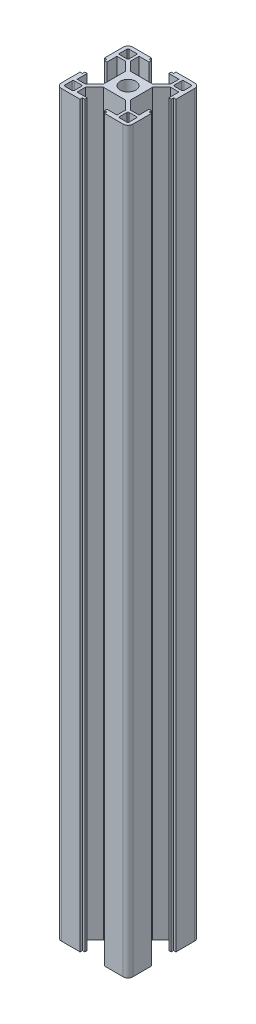
from build123d import *

# Parameters (mm, degrees)
SKETCH1_W           = 4
SKETCH1_H           = 4
SKETCH1_R           = 3.25
BOSS_EXTRUDE1_DEPTH = 310
SKETCH2_W           = 1
SKETCH2_H           = 1
CUT_EXTRUDE1_DEPTH  = 311.724958766
FILLET1_R           = 0.5


with BuildPart() as part:
    # Sketch1 → Boss-Extrude1 (new body)
    with BuildSketch(Plane(origin=(0, 0, 0), x_dir=(1, 0, 0), z_dir=(0, 1, 0))):
        with BuildLine():
            Line((-8.375, 9.50637085), (-8.375, 13))
            Line((-8.375, 13), (-4.125, 13))
            Line((-4.125, 13), (-4.125, 15))
            Line((-4.125, 15), (-13, 15))
            ThreePointArc((-13, 15), (-14.414213562, 14.414213562), (-15, 13))
            Line((-15, 13), (-15, 4.125))
            Line((-15, 4.125), (-13, 4.125))
            Line((-13, 4.125), (-13, 8.375))
            Line((-13, 8.375), (-9.50637085, 8.375))
            Line((-9.50637085, 8.375), (-5.75, 4.61862915))
            Line((-5.75, 4.61862915), (-5.75, -4.61862915))
            Line((-5.75, -4.61862915), (-9.50637085, -8.375))
            Line((-9.50637085, -8.375), (-13, -8.375))
            Line((-13, -8.375), (-13, -4.125))
            Line((-13, -4.125), (-15, -4.125))
            Line((-15, -4.125), (-15, -13))
            ThreePointArc((-15, -13), (-14.414213562, -14.414213562), (-13, -15))
            Line((-13, -15), (-4.125, -15))
            Line((-4.125, -15), (-4.125, -13))
            Line((-4.125, -13), (-8.375, -13))
            Line((-8.375, -13), (-8.375, -9.50637085))
            Line((-8.375, -9.50637085), (-4.61862915, -5.75))
            Line((-4.61862915, -5.75), (4.61862915, -5.75))
            Line((4.61862915, -5.75), (8.375, -9.50637085))
            Line((8.375, -9.50637085), (8.375, -13))
            Line((8.375, -13), (4.125, -13))
            Line((4.125, -13), (4.125, -15))
            Line((4.125, -15), (13, -15))
            ThreePointArc((13, -15), (14.414213562, -14.414213562), (15, -13))
            Line((15, -13), (15, -4.125))
            Line((15, -4.125), (13, -4.125))
            Line((13, -4.125), (13, -8.375))
            Line((13, -8.375), (9.50637085, -8.375))
            Line((9.50637085, -8.375), (5.75, -4.61862915))
            Line((5.75, -4.61862915), (5.75, 4.61862915))
            Line((5.75, 4.61862915), (9.50637085, 8.375))
            Line((9.50637085, 8.375), (13, 8.375))
            Line((13, 8.375), (13, 4.125))
            Line((13, 4.125), (15, 4.125))
            Line((15, 4.125), (15, 13))
            ThreePointArc((15, 13), (14.414213562, 14.414213562), (13, 15))
            Line((13, 15), (4.125, 15))
            Line((4.125, 15), (4.125, 13))
            Line((4.125, 13), (8.375, 13))
            Line((8.375, 13), (8.375, 9.50637085))
            Line((8.375, 9.50637085), (4.61862915, 5.75))
            Line((4.61862915, 5.75), (-4.61862915, 5.75))
            Line((-4.61862915, 5.75), (-8.375, 9.50637085))
        make_face()
        with Locations((-11.5, -11.5)):
            Rectangle(SKETCH1_W, SKETCH1_H, mode=Mode.SUBTRACT)
        with Locations((11.5, -11.5)):
            Rectangle(SKETCH1_W, SKETCH1_H, mode=Mode.SUBTRACT)
        Polygon((-9.5, 9.5), (-10.63137085, 9.5), (-13.5, 9.5), (-13.5, 13.5), (-9.5, 13.5), align=None, mode=Mode.SUBTRACT)
        Circle(SKETCH1_R, mode=Mode.SUBTRACT)
        with Locations((11.5, 11.5)):
            Rectangle(SKETCH1_W, SKETCH1_H, mode=Mode.SUBTRACT)
    extrude(amount=BOSS_EXTRUDE1_DEPTH)

    # Sketch2 → Cut-Extrude1 (cut, through all)
    with BuildSketch(Plane(origin=(0, 310, 0), x_dir=(1, 0, 0), z_dir=(0, 1, 0))):
        with Locations((14.5, 4.625)):
            Rectangle(SKETCH2_W, SKETCH2_H)
        with Locations((-4.625, 14.5)):
            Rectangle(SKETCH2_W, SKETCH2_H)
        with Locations((4.625, 14.5)):
            Rectangle(SKETCH2_W, SKETCH2_H)
        with Locations((14.5, -4.625)):
            Rectangle(SKETCH2_W, SKETCH2_H)
        with Locations((4.625, -14.5)):
            Rectangle(SKETCH2_W, SKETCH2_H)
        with Locations((-4.625, -14.5)):
            Rectangle(SKETCH2_W, SKETCH2_H)
        with Locations((-14.5, -4.625)):
            Rectangle(SKETCH2_W, SKETCH2_H)
        with Locations((-14.5, 4.625)):
            Rectangle(SKETCH2_W, SKETCH2_H)
    extrude(amount=-CUT_EXTRUDE1_DEPTH, mode=Mode.SUBTRACT)

    # Fillet1
    fillet1_edges = [part.edges().sort_by_distance(p)[0] for p in [
        (9.5, 155, 13.5),
        (-13.5, 155, 13.5),
        (-13.5, 155, -9.5),
        (9.5, 155, -9.5),
        (-13.5, 155, 9.5),
        (9.5, 155, 9.5),
        (9.5, 155, -13.5),
        (-13.5, 155, -13.5),
        (-9.5, 155, -13.5),
        (13.5, 155, -13.5),
        (13.5, 155, 9.5),
        (-9.5, 155, 9.5),
        (13.5, 155, 13.5),
        (-9.5, 155, 13.5),
        (-9.5, 155, -9.5),
        (13.5, 155, -9.5),
    ]]
    fillet(fillet1_edges, radius=FILLET1_R)


solid = part.part
